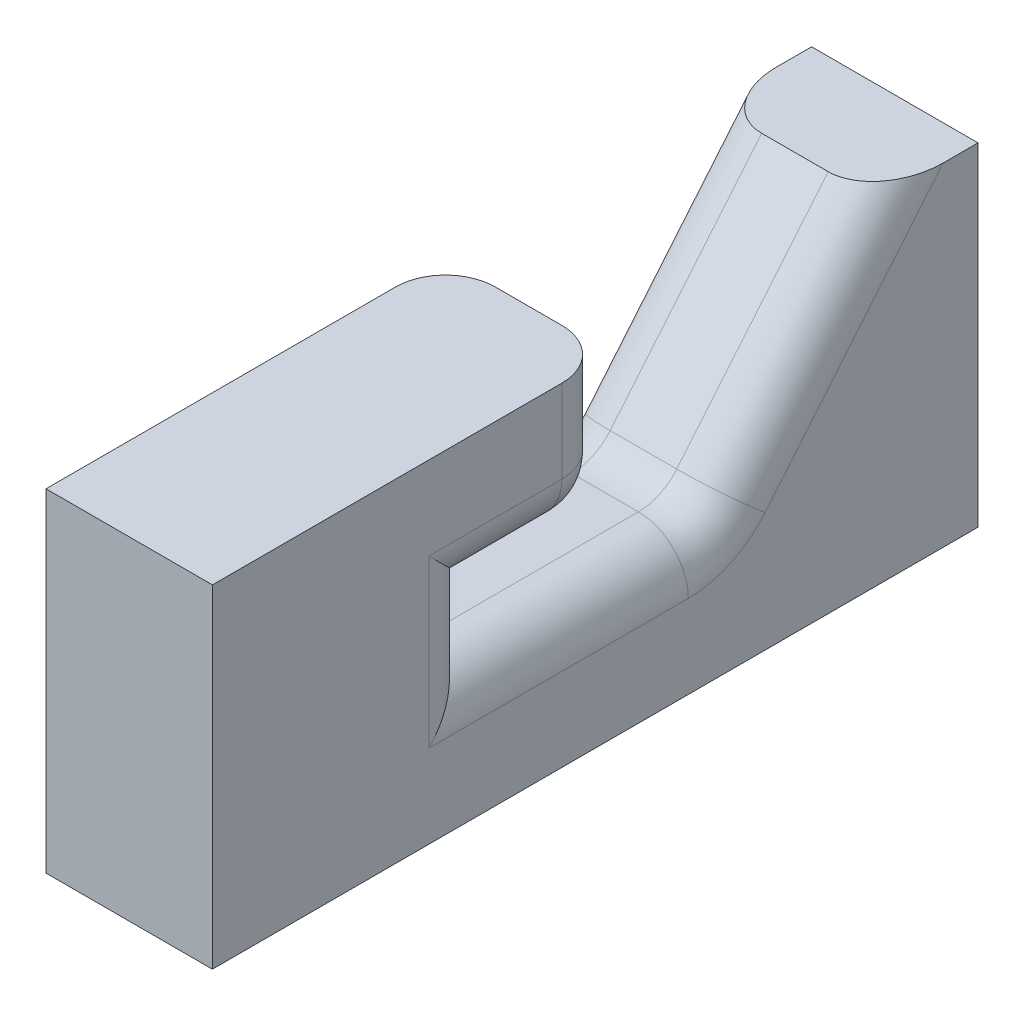
from build123d import *

# Parameters (mm, degrees)
SKETCH2_W           = 10
SKETCH2_H           = 23
BOSS_EXTRUDE1_DEPTH = 5
CUT_EXTRUDE1_DEPTH  = 26.573423705
FILLET2_R           = 1.5


with BuildPart() as part:
    # Sketch2 → Boss-Extrude1 (new body)
    with BuildSketch(Plane.YZ):
        with Locations((5, 11.5)):
            Rectangle(SKETCH2_W, SKETCH2_H)
    extrude(amount=BOSS_EXTRUDE1_DEPTH)

    # Sketch3 → Cut-Extrude1 (cut, through all)
    with BuildSketch(Plane.YZ.offset(5)):
        Polygon((10, 11), (6, 11), (6, 15), (4, 15), (4, 8), (10, 3), align=None)
    extrude(amount=-CUT_EXTRUDE1_DEPTH, mode=Mode.SUBTRACT)

    # Fillet2
    fillet2_edges = [part.edges().sort_by_distance(p)[0] for p in [
        (2.5, 6, 11),
        (5, 6, 13),
        (5, 4, 11.5),
        (5, 5, 15),
        (0, 4, 11.5),
        (0, 5, 15),
        (0, 6, 13),
        (0, 7, 5.5),
        (5, 7, 5.5),
        (2.5, 4, 8),
        (0, 8, 11),
        (5, 8, 11),
    ]]
    fillet(fillet2_edges, radius=FILLET2_R)


solid = part.part
